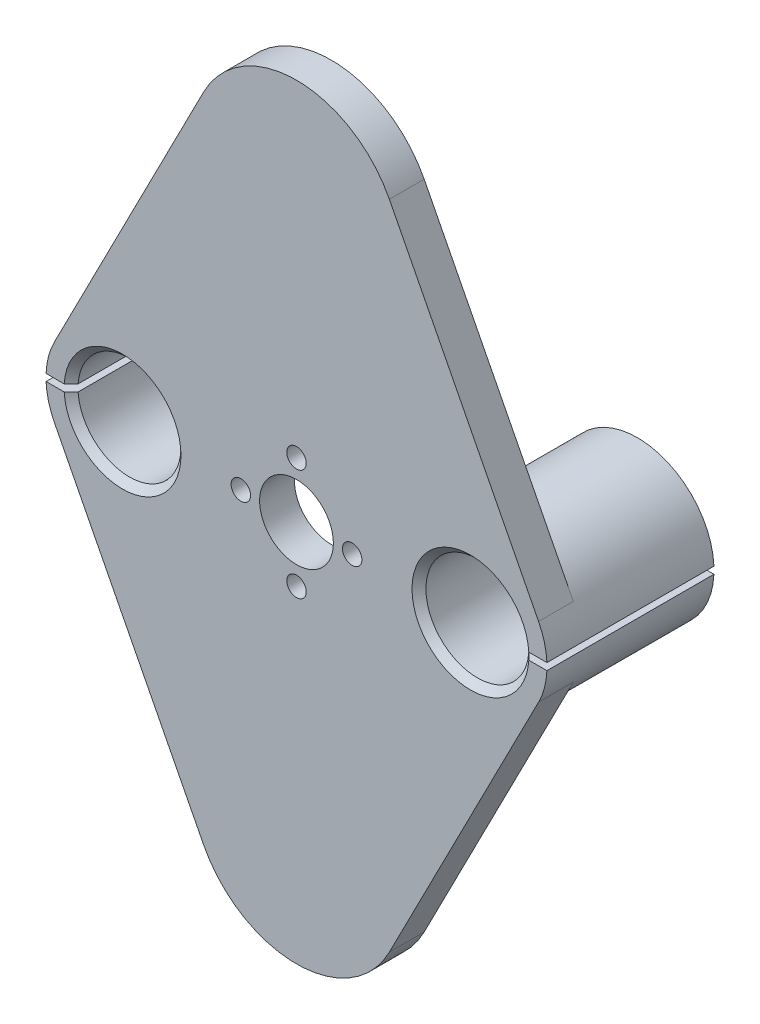
from build123d import *

# Parameters (mm, degrees)
SKETCH1_R           = 5.3
BOSS_EXTRUDE1_DEPTH = 5
BOSS_EXTRUDE2_START = 19
SKETCH2_R           = 11
BOSS_EXTRUDE2_DEPTH = 19
CUT_EXTRUDE1_REACH  = 120.203
SKETCH3_R           = 7.4
CUT_EXTRUDE2_REACH  = 134.834
SKETCH6_W           = 24
SKETCH6_H           = 1
CUT_EXTRUDE3_REACH  = 120.2
SKETCH4_R           = 1.4
SZYK_KO_OWY1_COUNT  = 4
SFAZOWANIE1_SIZE    = 1


with BuildPart() as part:
    # Sketch1 → Boss-Extrude1 (new body)
    with BuildSketch(Plane.XY):
        with BuildLine():
            Line((-34.788764045, 60.017977528), (-13.348314607, 101.842696629))
            ThreePointArc((-13.348314607, 101.842696629), (0, 110), (13.348314607, 101.842696629))
            Line((13.348314607, 101.842696629), (34.788764045, 60.017977528))
            ThreePointArc((34.788764045, 60.017977528), (36, 55), (34.788764045, 49.982022472))
            Line((34.788764045, 49.982022472), (13.348314607, 8.157303371))
            ThreePointArc((13.348314607, 8.157303371), (0, 0), (-13.348314607, 8.157303371))
            Line((-13.348314607, 8.157303371), (-34.788764045, 49.982022472))
            ThreePointArc((-34.788764045, 49.982022472), (-36, 55), (-34.788764045, 60.017977528))
        make_face()
        with Locations((0, 55)):
            Circle(SKETCH1_R, mode=Mode.SUBTRACT)
    extrude(amount=BOSS_EXTRUDE1_DEPTH)

    # Sketch2 → Boss-Extrude2 (add)
    with BuildSketch(Plane(origin=(0, 0, 0), x_dir=(-1, 0, 0), z_dir=(0, 0, -1)).offset(BOSS_EXTRUDE2_START)):
        with Locations((-25, 55)):
            Circle(SKETCH2_R)
        with Locations((25, 55)):
            Circle(SKETCH2_R)
    extrude(amount=-BOSS_EXTRUDE2_DEPTH)

    # Sketch3 → Cut-Extrude1 (cut, up to next)
    with BuildSketch(Plane(origin=(0, 0, -19), x_dir=(-1, 0, 0), z_dir=(0, 0, -1)), mode=Mode.PRIVATE) as cut_extrude1_sk1:
        with Locations((-25, 55)):
            Circle(SKETCH3_R)
    cut_extrude1_tool1 = extrude(cut_extrude1_sk1.sketch, amount=-CUT_EXTRUDE1_REACH, mode=Mode.PRIVATE) & part.part
    # Sketch3 → Cut-Extrude1 (cut, up to next)
    with BuildSketch(Plane(origin=(0, 0, -19), x_dir=(-1, 0, 0), z_dir=(0, 0, -1)), mode=Mode.PRIVATE) as cut_extrude1_sk2:
        with Locations((25, 55)):
            Circle(SKETCH3_R)
    cut_extrude1_tool2 = extrude(cut_extrude1_sk2.sketch, amount=-CUT_EXTRUDE1_REACH, mode=Mode.PRIVATE) & part.part
    add(cut_extrude1_tool1.solids().sort_by_distance((25, 55, -19))[0], mode=Mode.SUBTRACT)
    add(cut_extrude1_tool2.solids().sort_by_distance((-25, 55, -19))[0], mode=Mode.SUBTRACT)

    # Sketch6 → Cut-Extrude2 (cut, up to next)
    with BuildSketch(Plane(origin=(36, 0, 0), x_dir=(0, 0, -1), z_dir=(1, 0, 0)), mode=Mode.PRIVATE) as cut_extrude2_sk1:
        with Locations((7, 55)):
            Rectangle(SKETCH6_W, SKETCH6_H)
    cut_extrude2_tool1 = extrude(cut_extrude2_sk1.sketch, amount=-CUT_EXTRUDE2_REACH, mode=Mode.PRIVATE) & part.part
    cut_extrude2 = cut_extrude2_tool1.solids().sort_by_distance((36, 55, -7))[0]
    add(cut_extrude2, mode=Mode.SUBTRACT)

    # Mirror1: Cut-Extrude2 across plane
    add(cut_extrude2.mirror(Plane(origin=(0, 0, 0), x_dir=(0, 0, 1), z_dir=(1, 0, 0))), mode=Mode.SUBTRACT)

    # Sketch4 → Cut-Extrude3 (cut, up to next)
    with BuildSketch(Plane.XY.offset(5), mode=Mode.PRIVATE) as cut_extrude3_sk1:
        with Locations((-8, 55)):
            Circle(SKETCH4_R)
    cut_extrude3_tool1 = extrude(cut_extrude3_sk1.sketch, amount=-CUT_EXTRUDE3_REACH, mode=Mode.PRIVATE) & part.part
    cut_extrude3 = cut_extrude3_tool1.solids().sort_by_distance((-8, 55, 5))[0]
    add(cut_extrude3, mode=Mode.SUBTRACT)

    # Szyk kołowy1: Cut-Extrude3 ×4 about axis
    szyk_ko_owy1_axis = Axis((0, 55, 5), (0, 0, 1))
    for i in range(1, SZYK_KO_OWY1_COUNT):
        add(cut_extrude3.rotate(szyk_ko_owy1_axis, i * 360 / SZYK_KO_OWY1_COUNT), mode=Mode.SUBTRACT)

    # Sfazowanie1
    sfazowanie1_edges = [part.edges().sort_by_distance(p)[0] for p in [
        (24.749857046, 47.604229012, -19),
        (-17.6, 55, -19),
        (24.749857046, 47.604229012, 5),
        (-17.6, 55, 5),
    ]]
    chamfer(sfazowanie1_edges, length=SFAZOWANIE1_SIZE)


solid = part.part
